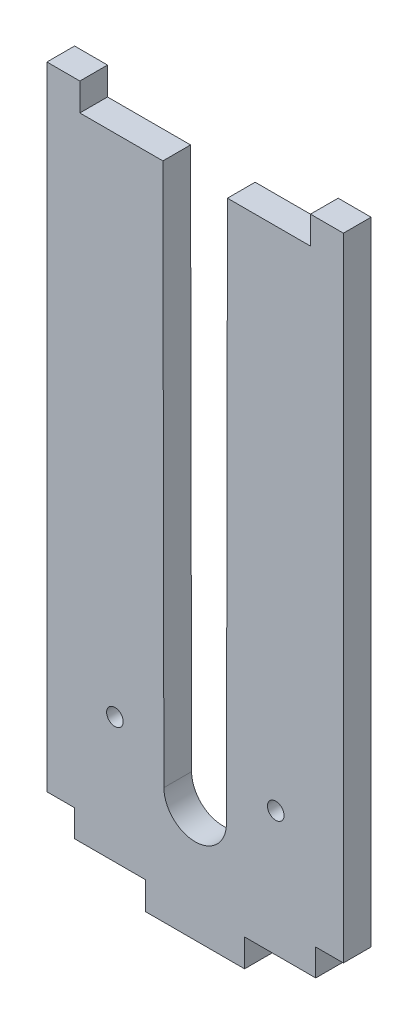
from build123d import *

# Parameters (mm, degrees)
SKETCH1_W           = 57.15
SKETCH1_H           = 127
BOSS_EXTRUDE3_DEPTH = 5.334
CUT_EXTRUDE2_DEPTH  = 140.368483008
SKETCH8_W           = 19.05
SKETCH8_H           = 5.334
CUT_EXTRUDE6_DEPTH  = 5.334
SKETCH8_5_W         = 19.05
SKETCH8_5_H         = 5.334
CUT_EXTRUDE7_DEPTH  = 5.334
SKETCH16_W          = 22.352
SKETCH16_H          = 5.334
BOSS_EXTRUDE4_DEPTH = 5.334
SKETCH29_W          = 5.334
SKETCH29_H          = 4.79425
CUT_EXTRUDE11_DEPTH = 5.334
SKETCH31_W          = 5.334
SKETCH31_H          = 4.79425
CUT_EXTRUDE12_DEPTH = 5.334
SKETCH32_W          = 16.002
SKETCH32_H          = 5.334
CUT_EXTRUDE13_DEPTH = 5.334
SKETCH33_W          = 5.334
SKETCH33_H          = 0.381
CUT_EXTRUDE14_DEPTH = 145.245837417
SKETCH35_R          = 1.6
CUT_EXTRUDE15_DEPTH = 145.245837417


with BuildPart() as part:
    # Sketch1 → Boss-Extrude3 (new body)
    with BuildSketch(Plane.XY):
        with Locations((28.575, 63.5)):
            Rectangle(SKETCH1_W, SKETCH1_H)
    extrude(amount=BOSS_EXTRUDE3_DEPTH)

    # Sketch3 → Cut-Extrude2 (cut, through all)
    with BuildSketch(Plane.XY.offset(5.334)):
        with BuildLine():
            Line((34.601815113, 22.479), (34.798, 127))
            Line((34.798, 127), (22.352, 127))
            Line((22.352, 127), (22.548184887, 22.479))
            ThreePointArc((22.548184887, 22.479), (28.575, 16.452184887), (34.601815113, 22.479))
        make_face()
    extrude(amount=-CUT_EXTRUDE2_DEPTH, mode=Mode.SUBTRACT)

    # Sketch8 → Cut-Extrude6 (cut)
    with BuildSketch(Plane.XZ):
        with Locations((47.625, 2.667)):
            Rectangle(SKETCH8_W, SKETCH8_H)
    extrude(amount=-CUT_EXTRUDE6_DEPTH, mode=Mode.SUBTRACT)

    # Sketch8<5> → Cut-Extrude7 (cut)
    with BuildSketch(Plane.XZ):
        with Locations((47.625, 2.667)):
            Rectangle(SKETCH8_5_W, SKETCH8_5_H)
        with Locations((9.525, 2.667)):
            Rectangle(SKETCH8_5_W, SKETCH8_5_H)
    extrude(amount=-CUT_EXTRUDE7_DEPTH, mode=Mode.SUBTRACT)

    # Sketch16 → Boss-Extrude4 (add)
    with BuildSketch(Plane(origin=(0, 127, 0), x_dir=(1, 0, 0), z_dir=(0, 1, 0))):
        with Locations((45.974, -2.667)):
            Rectangle(SKETCH16_W, SKETCH16_H)
        with Locations((11.176, -2.667)):
            Rectangle(SKETCH16_W, SKETCH16_H)
    extrude(amount=BOSS_EXTRUDE4_DEPTH)

    # Sketch29 → Cut-Extrude11 (cut)
    with BuildSketch(Plane(origin=(57.15, 0, 0), x_dir=(0, 0, -1), z_dir=(1, 0, 0))):
        with Locations((-2.667, 7.731125)):
            Rectangle(SKETCH29_W, SKETCH29_H)
    extrude(amount=-CUT_EXTRUDE11_DEPTH, mode=Mode.SUBTRACT)

    # Sketch31 → Cut-Extrude12 (cut)
    with BuildSketch(Plane.ZY):
        with Locations((2.667, 7.731125)):
            Rectangle(SKETCH31_W, SKETCH31_H)
    extrude(amount=-CUT_EXTRUDE12_DEPTH, mode=Mode.SUBTRACT)

    # Sketch32 → Cut-Extrude13 (cut)
    with BuildSketch(Plane(origin=(0, 132.334, 0), x_dir=(1, 0, 0), z_dir=(0, 1, 0))):
        with Locations((14.351, -2.667)):
            Rectangle(SKETCH32_W, SKETCH32_H)
        with Locations((42.799, -2.667)):
            Rectangle(SKETCH32_W, SKETCH32_H)
    extrude(amount=-CUT_EXTRUDE13_DEPTH, mode=Mode.SUBTRACT)

    # Sketch33 → Cut-Extrude14 (cut, through all)
    with BuildSketch(Plane(origin=(0, 0, 0), x_dir=(-1, 0, 0), z_dir=(0, 0, -1))):
        with Locations((-54.483, 10.31875)):
            Rectangle(SKETCH33_W, SKETCH33_H)
        with Locations((-2.667, 10.31875)):
            Rectangle(SKETCH33_W, SKETCH33_H)
    extrude(amount=-CUT_EXTRUDE14_DEPTH, mode=Mode.SUBTRACT)

    # Sketch35 → Cut-Extrude15 (cut, through all)
    with BuildSketch(Plane.XY.offset(5.334)):
        with Locations((13.107594454, 29.550730033)):
            Circle(SKETCH35_R)
        with Locations((44.107261808, 29.40711974)):
            Circle(SKETCH35_R)
    extrude(amount=-CUT_EXTRUDE15_DEPTH, mode=Mode.SUBTRACT)


solid = part.part
